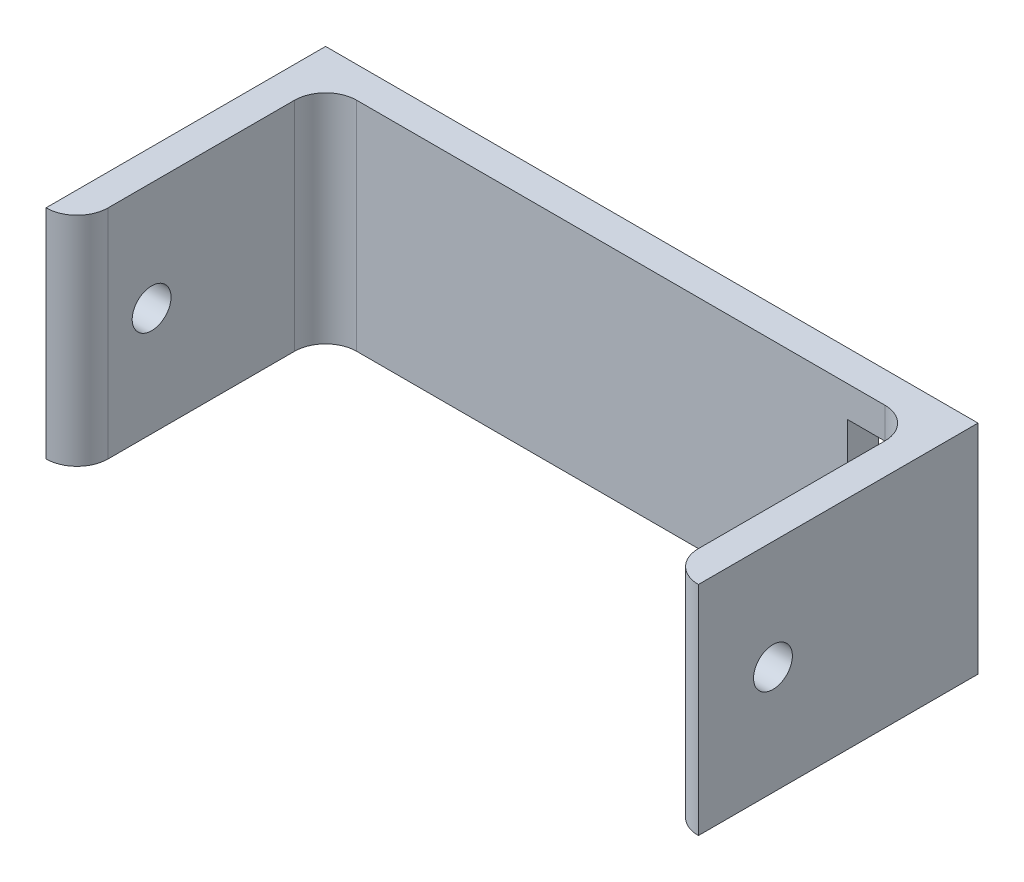
from build123d import *

# Parameters (mm, degrees)
BOSS_EXTRUDE1_DEPTH     = 44.45
FILLET1_R               = 6.35
FILLET2_R               = 6.35
SKETCH4_R               = 3.96875
CUT_EXTRUDE2_DEPTH      = 254
CUT_EXTRUDE4_DEPTH      = 150.461249158
CUT_EXTRUDE4_DEPTH_BACK = 150.461249158
SKETCH5_W               = 11.43
SKETCH5_H               = 31.75


with BuildPart() as part:
    # Sketch1 → Boss-Extrude1 (new body)
    with BuildSketch(Plane(origin=(0, 0, 0), x_dir=(1, 0, 0), z_dir=(0, 1, 0))):
        Polygon((0, 0), (0, 57.15), (133.35, 57.15), (133.35, 0), (127, 0), (127, 50.8), (6.35, 50.8), (6.35, 0), align=None)
    extrude(amount=BOSS_EXTRUDE1_DEPTH)

    # Fillet1
    fillet1_edges = [part.edges().sort_by_distance(p)[0] for p in [
        (6.35, 22.225, -50.8),
        (127, 22.225, -50.8),
    ]]
    fillet(fillet1_edges, radius=FILLET1_R)

    # Fillet2
    fillet2_edges = [part.edges().sort_by_distance(p)[0] for p in [
        (127, 22.225, 0),
        (6.35, 22.225, 0),
    ]]
    fillet(fillet2_edges, radius=FILLET2_R - 0.0001)  # a hair under: the kernel refuses the full size

    # Sketch4 → Cut-Extrude2 (cut)
    with BuildSketch(Plane(origin=(139.7, 1.415162488, -69.948790088), x_dir=(0, 0, -1), z_dir=(1, 0, 0))):
        with Locations((-54.708790088, 20.809837512)):
            Circle(SKETCH4_R)
    extrude(amount=-CUT_EXTRUDE2_DEPTH, mode=Mode.SUBTRACT)

    # Sketch5 → Cut-Extrude4 (cut, two sides: drawn at the far end of the back side and taken through both)
    with BuildSketch(Plane.XY.offset(-50.8).offset(-CUT_EXTRUDE4_DEPTH_BACK)):
        with Locations((118.745, 22.225)):
            Rectangle(SKETCH5_W, SKETCH5_H)
    extrude(amount=CUT_EXTRUDE4_DEPTH + CUT_EXTRUDE4_DEPTH_BACK, mode=Mode.SUBTRACT)


solid = part.part
